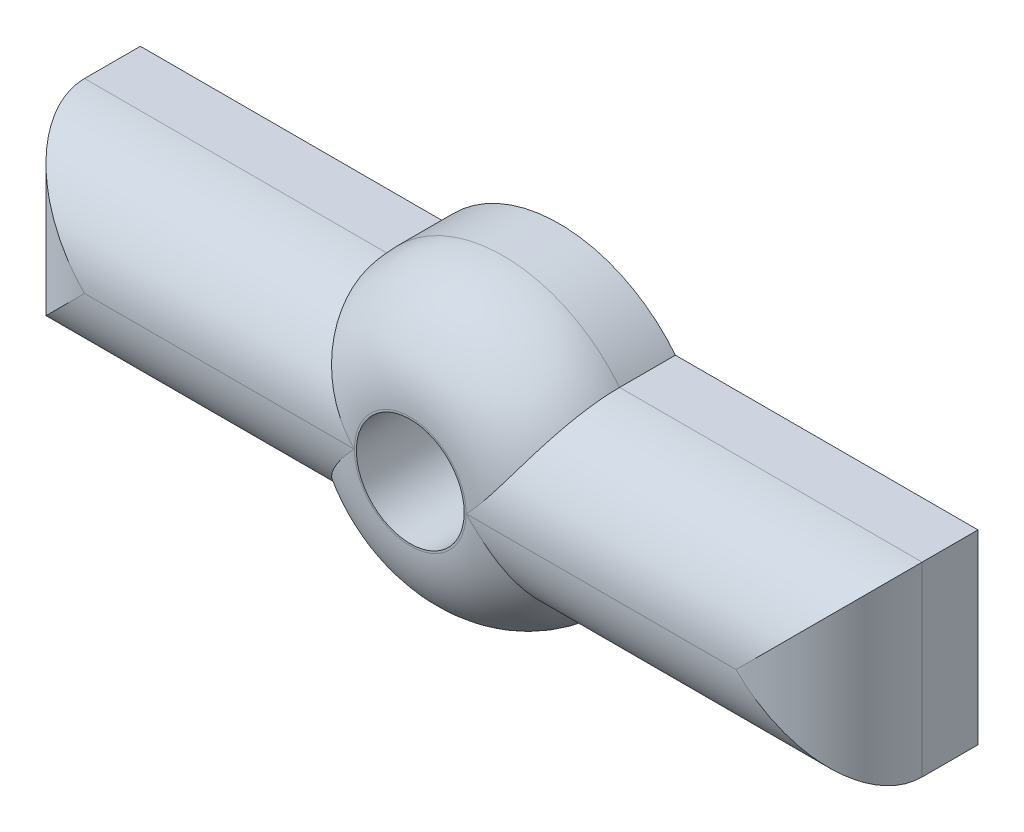
from build123d import *

# Parameters (mm, degrees)
BOSS_EXTRU_2_DEPTH = 8
CONG_1_R           = 5
D_GAGEMENT_121_D   = 5.7912


with BuildPart() as part:
    # Esquisse1 → Boss.-Extru.2 (new body)
    with BuildSketch(Plane.XY):
        with BuildLine():
            Line((-22.5, 5), (-6.244997998, 5))
            ThreePointArc((-6.244997998, 5), (0, 8), (6.244997998, 5))
            Line((6.244997998, 5), (22.5, 5))
            Line((22.5, 5), (22.5, -5))
            Line((22.5, -5), (6.244997998, -5))
            ThreePointArc((6.244997998, -5), (0, -8), (-6.244997998, -5))
            Line((-6.244997998, -5), (-22.5, -5))
            Line((-22.5, -5), (-22.5, 5))
        make_face()
    extrude(amount=BOSS_EXTRU_2_DEPTH)

    # Congé1
    cong_1_edges = [part.edges().sort_by_distance(p)[0] for p in [
        (0, -8, 8),
        (14.372498999, -5, 8),
        (22.5, 0, 8),
        (14.372498999, 5, 8),
        (0, 8, 8),
        (-14.372498999, 5, 8),
        (-22.5, 0, 8),
        (-14.372498999, -5, 8),
    ]]
    fillet(cong_1_edges, radius=CONG_1_R - 0.0001)  # a hair under: the kernel refuses the full size

    # Dégagement #121 (through all)
    with Locations(Plane.XY.offset(8)):
        with Locations((0, 0)):
            Hole(D_GAGEMENT_121_D / 2)


solid = part.part
